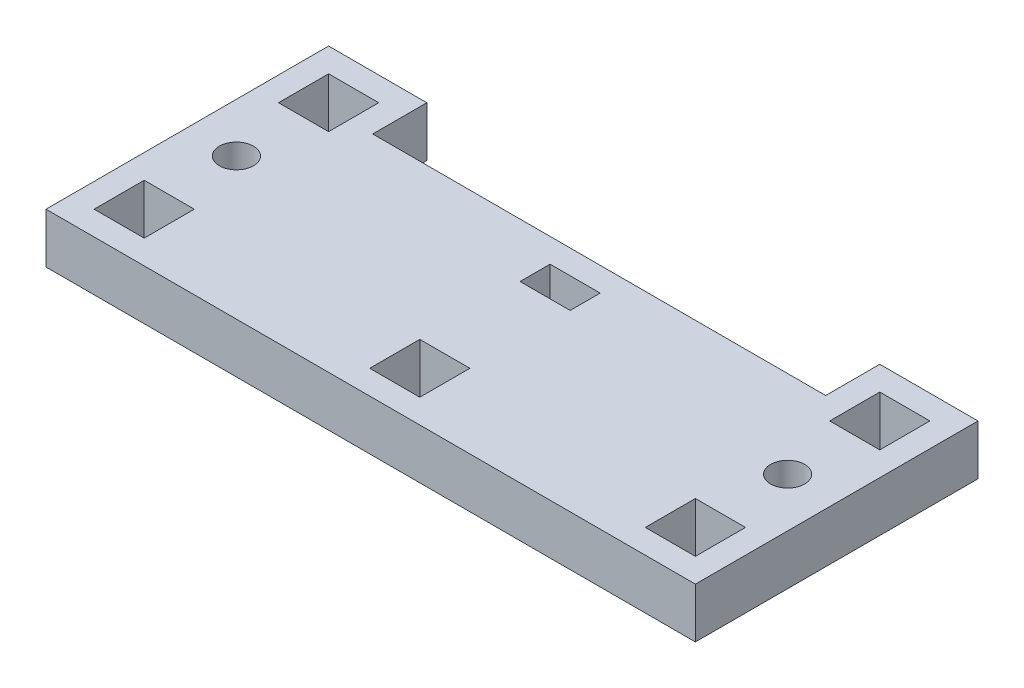
from build123d import *

# Parameters (mm, degrees)
SKETCH1_R           = 2.159
SKETCH1_W           = 6.35
SKETCH1_H           = 6.35
SKETCH1_H_2         = 3.81
BOSS_EXTRUDE1_DEPTH = 6.35


with BuildPart() as part:
    # Sketch1 → Boss-Extrude1 (new body)
    with BuildSketch(Plane(origin=(0, 0, 0), x_dir=(1, 0, 0), z_dir=(0, 1, 0))):
        Polygon((-41.148, -17.907), (41.148, -17.907), (41.148, 17.907), (28.702, 17.907), (28.702, 11.049), (-28.702, 11.049), (-28.702, 17.907), (-41.148, 17.907), align=None)
        with Locations((34.925, 0)):
            Circle(SKETCH1_R, mode=Mode.SUBTRACT)
        with Locations((-34.925, 0)):
            Circle(SKETCH1_R, mode=Mode.SUBTRACT)
        with Locations((0, -11.684)):
            Rectangle(SKETCH1_W, SKETCH1_H, mode=Mode.SUBTRACT)
        with Locations((0, 6.096)):
            Rectangle(SKETCH1_W, SKETCH1_H_2, mode=Mode.SUBTRACT)
        with Locations((34.925, 11.684)):
            Rectangle(SKETCH1_W, SKETCH1_H, mode=Mode.SUBTRACT)
        with Locations((34.925, -11.684)):
            Rectangle(SKETCH1_W, SKETCH1_H, mode=Mode.SUBTRACT)
        with Locations((-34.925, 11.684)):
            Rectangle(SKETCH1_W, SKETCH1_H, mode=Mode.SUBTRACT)
        with Locations((-34.925, -11.684)):
            Rectangle(SKETCH1_W, SKETCH1_H, mode=Mode.SUBTRACT)
    extrude(amount=BOSS_EXTRUDE1_DEPTH)


solid = part.part
